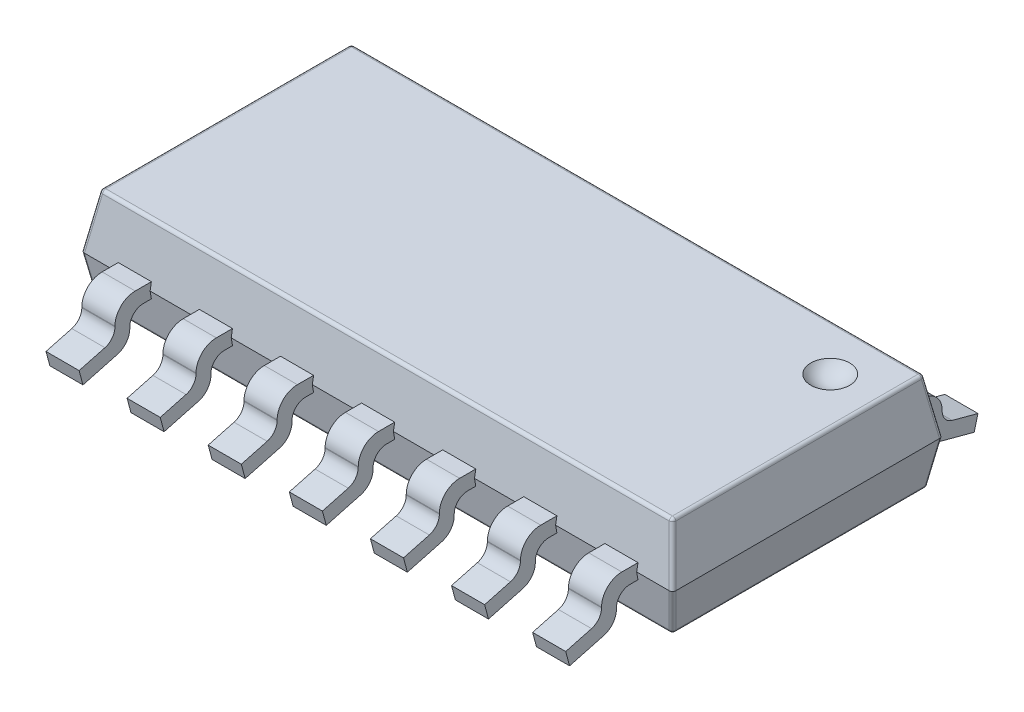
from build123d import *

# Parameters (mm, degrees)
BOSS_EXTRUDE1_DEPTH   = 4.375
CUT_EXTRUDE1_DEPTH    = 4.375
FILLET1_R             = 0.05
BOSS_EXTRUDE2_DEPTH   = 0.245
LPATTERN1_COUNT       = 4
LPATTERN1_PITCH       = 1.2
LPATTERN1_COUNT_DIR2  = 4
LPATTERN1_PITCH_DIR2  = 1.2
MIRROR1_COPY_1_DEPTH  = 0.245
MIRROR1_COPY_2_DEPTH  = 0.245
MIRROR1_COPY_3_DEPTH  = 0.245
MIRROR1_COPY_4_DEPTH  = 0.245
MIRROR1_COPY_5_DEPTH  = 0.245
MIRROR1_COPY_6_DEPTH  = 0.245
MIRROR1_COPY_7_DEPTH  = 0.245
MIRROR1_COPY_8_DEPTH  = 0.245
MIRROR1_COPY_9_DEPTH  = 0.245
MIRROR1_COPY_10_DEPTH = 0.245
MIRROR1_COPY_11_DEPTH = 0.245
MIRROR1_COPY_12_DEPTH = 0.245
MIRROR1_COPY_13_DEPTH = 0.245
MIRROR1_COPY_14_DEPTH = 0.245
MIRROR1_COPY_15_DEPTH = 0.245


with BuildPart() as part:
    # Sketch3 → Boss-Extrude1 (new, symmetric)
    with BuildSketch(Plane(origin=(0, 0, 0), x_dir=(0, 0, -1), z_dir=(1, 0, 0))):
        Polygon((-2, 0), (-1.885387463, -0.65), (1.885387463, -0.65), (2, 0), (1.858938415, 0.8), (-1.858938415, 0.8), align=None)
    extrude(amount=BOSS_EXTRUDE1_DEPTH, both=True)

    # Sketch4 → Cut-Extrude1 (cut, symmetric)
    with BuildSketch(Plane.XY):
        Polygon((-4.375, 0), (-4.233938415, 0.8), (-4.741857138, 0.8), (-4.741857138, -0.65), (-4.260387463, -0.65), align=None)
        Polygon((4.741857138, -0.65), (4.741857138, 0.8), (4.233938415, 0.8), (4.375, 0), (4.260387463, -0.65), align=None)
    extrude(amount=CUT_EXTRUDE1_DEPTH, both=True, mode=Mode.SUBTRACT)

    # Fillet1
    fillet1_edges = [part.edges().sort_by_distance(p)[0] for p in [
        (0, -0.65, -1.885387463),
        (-4.260387463, -0.65, 0),
        (0, -0.65, 1.885387463),
        (-4.233938415, 0.8, 0),
        (0, 0.8, -1.858938415),
        (4.317693731, -0.325, -1.942693731),
        (4.304469208, 0.4, -1.929469208),
        (4.233938415, 0.8, 0),
        (4.260387463, -0.65, 0),
        (4.317693731, -0.325, 1.942693731),
        (4.304469208, 0.4, 1.929469208),
        (0, 0.8, 1.858938415),
        (-4.317693731, -0.325, 1.942693731),
        (-4.304469208, 0.4, 1.929469208),
        (-4.317693731, -0.325, -1.942693731),
        (-4.304469208, 0.4, -1.929469208),
    ]]
    fillet(fillet1_edges, radius=FILLET1_R)

    # Sketch5 → Boss-Extrude2 (add, symmetric)
    with BuildSketch(Plane(origin=(0, 0, 0), x_dir=(0, 0, -1), z_dir=(1, 0, 0))):
        with BuildLine():
            Line((-1.980604032, 0.11), (-2, 0))
            Line((-2, 0), (-1.980604032, -0.11))
            Line((-1.980604032, -0.11), (-2.1, -0.11))
            ThreePointArc((-2.1, -0.11), (-2.241421356, -0.168578644), (-2.3, -0.31))
            Line((-2.3, -0.31), (-2.3, -0.329218636))
            ThreePointArc((-2.3, -0.329218636), (-2.351661665, -0.481408993), (-2.485295239, -0.570700092))
            Line((-2.485295239, -0.570700092), (-2.99305981, -0.706755199))
            Line((-2.99305981, -0.706755199), (-3.05, -0.494251518))
            Line((-3.05, -0.494251518), (-2.668236191, -0.391958213))
            ThreePointArc((-2.668236191, -0.391958213), (-2.561329332, -0.320525334), (-2.52, -0.198773048))
            Line((-2.52, -0.198773048), (-2.52, -0.19))
            ThreePointArc((-2.52, -0.19), (-2.432132034, 0.022132034), (-2.22, 0.11))
            Line((-2.22, 0.11), (-2.180725376, 0.11))
            Line((-2.180725376, 0.11), (-1.980604032, 0.11))
        make_face()
    boss_extrude2 = extrude(amount=BOSS_EXTRUDE2_DEPTH, both=True)

    # LPattern1: Boss-Extrude2 4 × 4
    with Locations(*[Vector(1, 0, 0) * (i * LPATTERN1_PITCH) + Vector(-1, 0, 0) * (j * LPATTERN1_PITCH_DIR2) for i in range(LPATTERN1_COUNT) for j in range(LPATTERN1_COUNT_DIR2) if (i, j) != (0, 0)]):
        add(boss_extrude2)

    # Mirror1: Boss-Extrude2 across plane
    add(boss_extrude2.mirror(Plane.XY))

    # Mirror1 copy 1 sketch → Mirror1 copy 1 (add, symmetric)
    with BuildSketch(Plane(origin=(-1.2, 0, 0), x_dir=(0, 0, 1), z_dir=(1, 0, 0))):
        with BuildLine():
            Line((-1.980604032, -0.11), (-2, 0))
            Line((-2, 0), (-1.980604032, 0.11))
            Line((-1.980604032, 0.11), (-2.1, 0.11))
            ThreePointArc((-2.1, 0.11), (-2.241421356, 0.168578644), (-2.3, 0.31))
            Line((-2.3, 0.31), (-2.3, 0.329218636))
            ThreePointArc((-2.3, 0.329218636), (-2.351661665, 0.481408993), (-2.485295239, 0.570700092))
            Line((-2.485295239, 0.570700092), (-2.99305981, 0.706755199))
            Line((-2.99305981, 0.706755199), (-3.05, 0.494251518))
            Line((-3.05, 0.494251518), (-2.668236191, 0.391958213))
            ThreePointArc((-2.668236191, 0.391958213), (-2.561329332, 0.320525334), (-2.52, 0.198773048))
            Line((-2.52, 0.198773048), (-2.52, 0.19))
            ThreePointArc((-2.52, 0.19), (-2.432132034, -0.022132034), (-2.22, -0.11))
            Line((-2.22, -0.11), (-2.180725376, -0.11))
            Line((-2.180725376, -0.11), (-1.980604032, -0.11))
        make_face()
    extrude(amount=MIRROR1_COPY_1_DEPTH, both=True)

    # Mirror1 copy 2 sketch → Mirror1 copy 2 (add, symmetric)
    with BuildSketch(Plane(origin=(-2.4, 0, 0), x_dir=(0, 0, 1), z_dir=(1, 0, 0))):
        with BuildLine():
            Line((-1.980604032, -0.11), (-2, 0))
            Line((-2, 0), (-1.980604032, 0.11))
            Line((-1.980604032, 0.11), (-2.1, 0.11))
            ThreePointArc((-2.1, 0.11), (-2.241421356, 0.168578644), (-2.3, 0.31))
            Line((-2.3, 0.31), (-2.3, 0.329218636))
            ThreePointArc((-2.3, 0.329218636), (-2.351661665, 0.481408993), (-2.485295239, 0.570700092))
            Line((-2.485295239, 0.570700092), (-2.99305981, 0.706755199))
            Line((-2.99305981, 0.706755199), (-3.05, 0.494251518))
            Line((-3.05, 0.494251518), (-2.668236191, 0.391958213))
            ThreePointArc((-2.668236191, 0.391958213), (-2.561329332, 0.320525334), (-2.52, 0.198773048))
            Line((-2.52, 0.198773048), (-2.52, 0.19))
            ThreePointArc((-2.52, 0.19), (-2.432132034, -0.022132034), (-2.22, -0.11))
            Line((-2.22, -0.11), (-2.180725376, -0.11))
            Line((-2.180725376, -0.11), (-1.980604032, -0.11))
        make_face()
    extrude(amount=MIRROR1_COPY_2_DEPTH, both=True)

    # Mirror1 copy 3 sketch → Mirror1 copy 3 (add, symmetric)
    with BuildSketch(Plane(origin=(-3.6, 0, 0), x_dir=(0, 0, 1), z_dir=(1, 0, 0))):
        with BuildLine():
            Line((-1.980604032, -0.11), (-2, 0))
            Line((-2, 0), (-1.980604032, 0.11))
            Line((-1.980604032, 0.11), (-2.1, 0.11))
            ThreePointArc((-2.1, 0.11), (-2.241421356, 0.168578644), (-2.3, 0.31))
            Line((-2.3, 0.31), (-2.3, 0.329218636))
            ThreePointArc((-2.3, 0.329218636), (-2.351661665, 0.481408993), (-2.485295239, 0.570700092))
            Line((-2.485295239, 0.570700092), (-2.99305981, 0.706755199))
            Line((-2.99305981, 0.706755199), (-3.05, 0.494251518))
            Line((-3.05, 0.494251518), (-2.668236191, 0.391958213))
            ThreePointArc((-2.668236191, 0.391958213), (-2.561329332, 0.320525334), (-2.52, 0.198773048))
            Line((-2.52, 0.198773048), (-2.52, 0.19))
            ThreePointArc((-2.52, 0.19), (-2.432132034, -0.022132034), (-2.22, -0.11))
            Line((-2.22, -0.11), (-2.180725376, -0.11))
            Line((-2.180725376, -0.11), (-1.980604032, -0.11))
        make_face()
    extrude(amount=MIRROR1_COPY_3_DEPTH, both=True)

    # Mirror1 copy 4 sketch → Mirror1 copy 4 (add, symmetric)
    with BuildSketch(Plane(origin=(1.2, 0, 0), x_dir=(0, 0, 1), z_dir=(1, 0, 0))):
        with BuildLine():
            Line((-1.980604032, -0.11), (-2, 0))
            Line((-2, 0), (-1.980604032, 0.11))
            Line((-1.980604032, 0.11), (-2.1, 0.11))
            ThreePointArc((-2.1, 0.11), (-2.241421356, 0.168578644), (-2.3, 0.31))
            Line((-2.3, 0.31), (-2.3, 0.329218636))
            ThreePointArc((-2.3, 0.329218636), (-2.351661665, 0.481408993), (-2.485295239, 0.570700092))
            Line((-2.485295239, 0.570700092), (-2.99305981, 0.706755199))
            Line((-2.99305981, 0.706755199), (-3.05, 0.494251518))
            Line((-3.05, 0.494251518), (-2.668236191, 0.391958213))
            ThreePointArc((-2.668236191, 0.391958213), (-2.561329332, 0.320525334), (-2.52, 0.198773048))
            Line((-2.52, 0.198773048), (-2.52, 0.19))
            ThreePointArc((-2.52, 0.19), (-2.432132034, -0.022132034), (-2.22, -0.11))
            Line((-2.22, -0.11), (-2.180725376, -0.11))
            Line((-2.180725376, -0.11), (-1.980604032, -0.11))
        make_face()
    extrude(amount=MIRROR1_COPY_4_DEPTH, both=True)

    # Mirror1 copy 5 sketch → Mirror1 copy 5 (add, symmetric)
    with BuildSketch(Plane(origin=(0, 0, 0), x_dir=(0, 0, 1), z_dir=(1, 0, 0))):
        with BuildLine():
            Line((-1.980604032, -0.11), (-2, 0))
            Line((-2, 0), (-1.980604032, 0.11))
            Line((-1.980604032, 0.11), (-2.1, 0.11))
            ThreePointArc((-2.1, 0.11), (-2.241421356, 0.168578644), (-2.3, 0.31))
            Line((-2.3, 0.31), (-2.3, 0.329218636))
            ThreePointArc((-2.3, 0.329218636), (-2.351661665, 0.481408993), (-2.485295239, 0.570700092))
            Line((-2.485295239, 0.570700092), (-2.99305981, 0.706755199))
            Line((-2.99305981, 0.706755199), (-3.05, 0.494251518))
            Line((-3.05, 0.494251518), (-2.668236191, 0.391958213))
            ThreePointArc((-2.668236191, 0.391958213), (-2.561329332, 0.320525334), (-2.52, 0.198773048))
            Line((-2.52, 0.198773048), (-2.52, 0.19))
            ThreePointArc((-2.52, 0.19), (-2.432132034, -0.022132034), (-2.22, -0.11))
            Line((-2.22, -0.11), (-2.180725376, -0.11))
            Line((-2.180725376, -0.11), (-1.980604032, -0.11))
        make_face()
    extrude(amount=MIRROR1_COPY_5_DEPTH, both=True)

    # Mirror1 copy 6 sketch → Mirror1 copy 6 (add, symmetric)
    with BuildSketch(Plane(origin=(-1.2, 0, 0), x_dir=(0, 0, 1), z_dir=(1, 0, 0))):
        with BuildLine():
            Line((-1.980604032, -0.11), (-2, 0))
            Line((-2, 0), (-1.980604032, 0.11))
            Line((-1.980604032, 0.11), (-2.1, 0.11))
            ThreePointArc((-2.1, 0.11), (-2.241421356, 0.168578644), (-2.3, 0.31))
            Line((-2.3, 0.31), (-2.3, 0.329218636))
            ThreePointArc((-2.3, 0.329218636), (-2.351661665, 0.481408993), (-2.485295239, 0.570700092))
            Line((-2.485295239, 0.570700092), (-2.99305981, 0.706755199))
            Line((-2.99305981, 0.706755199), (-3.05, 0.494251518))
            Line((-3.05, 0.494251518), (-2.668236191, 0.391958213))
            ThreePointArc((-2.668236191, 0.391958213), (-2.561329332, 0.320525334), (-2.52, 0.198773048))
            Line((-2.52, 0.198773048), (-2.52, 0.19))
            ThreePointArc((-2.52, 0.19), (-2.432132034, -0.022132034), (-2.22, -0.11))
            Line((-2.22, -0.11), (-2.180725376, -0.11))
            Line((-2.180725376, -0.11), (-1.980604032, -0.11))
        make_face()
    extrude(amount=MIRROR1_COPY_6_DEPTH, both=True)

    # Mirror1 copy 7 sketch → Mirror1 copy 7 (add, symmetric)
    with BuildSketch(Plane(origin=(-2.4, 0, 0), x_dir=(0, 0, 1), z_dir=(1, 0, 0))):
        with BuildLine():
            Line((-1.980604032, -0.11), (-2, 0))
            Line((-2, 0), (-1.980604032, 0.11))
            Line((-1.980604032, 0.11), (-2.1, 0.11))
            ThreePointArc((-2.1, 0.11), (-2.241421356, 0.168578644), (-2.3, 0.31))
            Line((-2.3, 0.31), (-2.3, 0.329218636))
            ThreePointArc((-2.3, 0.329218636), (-2.351661665, 0.481408993), (-2.485295239, 0.570700092))
            Line((-2.485295239, 0.570700092), (-2.99305981, 0.706755199))
            Line((-2.99305981, 0.706755199), (-3.05, 0.494251518))
            Line((-3.05, 0.494251518), (-2.668236191, 0.391958213))
            ThreePointArc((-2.668236191, 0.391958213), (-2.561329332, 0.320525334), (-2.52, 0.198773048))
            Line((-2.52, 0.198773048), (-2.52, 0.19))
            ThreePointArc((-2.52, 0.19), (-2.432132034, -0.022132034), (-2.22, -0.11))
            Line((-2.22, -0.11), (-2.180725376, -0.11))
            Line((-2.180725376, -0.11), (-1.980604032, -0.11))
        make_face()
    extrude(amount=MIRROR1_COPY_7_DEPTH, both=True)

    # Mirror1 copy 8 sketch → Mirror1 copy 8 (add, symmetric)
    with BuildSketch(Plane(origin=(2.4, 0, 0), x_dir=(0, 0, 1), z_dir=(1, 0, 0))):
        with BuildLine():
            Line((-1.980604032, -0.11), (-2, 0))
            Line((-2, 0), (-1.980604032, 0.11))
            Line((-1.980604032, 0.11), (-2.1, 0.11))
            ThreePointArc((-2.1, 0.11), (-2.241421356, 0.168578644), (-2.3, 0.31))
            Line((-2.3, 0.31), (-2.3, 0.329218636))
            ThreePointArc((-2.3, 0.329218636), (-2.351661665, 0.481408993), (-2.485295239, 0.570700092))
            Line((-2.485295239, 0.570700092), (-2.99305981, 0.706755199))
            Line((-2.99305981, 0.706755199), (-3.05, 0.494251518))
            Line((-3.05, 0.494251518), (-2.668236191, 0.391958213))
            ThreePointArc((-2.668236191, 0.391958213), (-2.561329332, 0.320525334), (-2.52, 0.198773048))
            Line((-2.52, 0.198773048), (-2.52, 0.19))
            ThreePointArc((-2.52, 0.19), (-2.432132034, -0.022132034), (-2.22, -0.11))
            Line((-2.22, -0.11), (-2.180725376, -0.11))
            Line((-2.180725376, -0.11), (-1.980604032, -0.11))
        make_face()
    extrude(amount=MIRROR1_COPY_8_DEPTH, both=True)

    # Mirror1 copy 9 sketch → Mirror1 copy 9 (add, symmetric)
    with BuildSketch(Plane(origin=(1.2, 0, 0), x_dir=(0, 0, 1), z_dir=(1, 0, 0))):
        with BuildLine():
            Line((-1.980604032, -0.11), (-2, 0))
            Line((-2, 0), (-1.980604032, 0.11))
            Line((-1.980604032, 0.11), (-2.1, 0.11))
            ThreePointArc((-2.1, 0.11), (-2.241421356, 0.168578644), (-2.3, 0.31))
            Line((-2.3, 0.31), (-2.3, 0.329218636))
            ThreePointArc((-2.3, 0.329218636), (-2.351661665, 0.481408993), (-2.485295239, 0.570700092))
            Line((-2.485295239, 0.570700092), (-2.99305981, 0.706755199))
            Line((-2.99305981, 0.706755199), (-3.05, 0.494251518))
            Line((-3.05, 0.494251518), (-2.668236191, 0.391958213))
            ThreePointArc((-2.668236191, 0.391958213), (-2.561329332, 0.320525334), (-2.52, 0.198773048))
            Line((-2.52, 0.198773048), (-2.52, 0.19))
            ThreePointArc((-2.52, 0.19), (-2.432132034, -0.022132034), (-2.22, -0.11))
            Line((-2.22, -0.11), (-2.180725376, -0.11))
            Line((-2.180725376, -0.11), (-1.980604032, -0.11))
        make_face()
    extrude(amount=MIRROR1_COPY_9_DEPTH, both=True)

    # Mirror1 copy 10 sketch → Mirror1 copy 10 (add, symmetric)
    with BuildSketch(Plane(origin=(0, 0, 0), x_dir=(0, 0, 1), z_dir=(1, 0, 0))):
        with BuildLine():
            Line((-1.980604032, -0.11), (-2, 0))
            Line((-2, 0), (-1.980604032, 0.11))
            Line((-1.980604032, 0.11), (-2.1, 0.11))
            ThreePointArc((-2.1, 0.11), (-2.241421356, 0.168578644), (-2.3, 0.31))
            Line((-2.3, 0.31), (-2.3, 0.329218636))
            ThreePointArc((-2.3, 0.329218636), (-2.351661665, 0.481408993), (-2.485295239, 0.570700092))
            Line((-2.485295239, 0.570700092), (-2.99305981, 0.706755199))
            Line((-2.99305981, 0.706755199), (-3.05, 0.494251518))
            Line((-3.05, 0.494251518), (-2.668236191, 0.391958213))
            ThreePointArc((-2.668236191, 0.391958213), (-2.561329332, 0.320525334), (-2.52, 0.198773048))
            Line((-2.52, 0.198773048), (-2.52, 0.19))
            ThreePointArc((-2.52, 0.19), (-2.432132034, -0.022132034), (-2.22, -0.11))
            Line((-2.22, -0.11), (-2.180725376, -0.11))
            Line((-2.180725376, -0.11), (-1.980604032, -0.11))
        make_face()
    extrude(amount=MIRROR1_COPY_10_DEPTH, both=True)

    # Mirror1 copy 11 sketch → Mirror1 copy 11 (add, symmetric)
    with BuildSketch(Plane(origin=(-1.2, 0, 0), x_dir=(0, 0, 1), z_dir=(1, 0, 0))):
        with BuildLine():
            Line((-1.980604032, -0.11), (-2, 0))
            Line((-2, 0), (-1.980604032, 0.11))
            Line((-1.980604032, 0.11), (-2.1, 0.11))
            ThreePointArc((-2.1, 0.11), (-2.241421356, 0.168578644), (-2.3, 0.31))
            Line((-2.3, 0.31), (-2.3, 0.329218636))
            ThreePointArc((-2.3, 0.329218636), (-2.351661665, 0.481408993), (-2.485295239, 0.570700092))
            Line((-2.485295239, 0.570700092), (-2.99305981, 0.706755199))
            Line((-2.99305981, 0.706755199), (-3.05, 0.494251518))
            Line((-3.05, 0.494251518), (-2.668236191, 0.391958213))
            ThreePointArc((-2.668236191, 0.391958213), (-2.561329332, 0.320525334), (-2.52, 0.198773048))
            Line((-2.52, 0.198773048), (-2.52, 0.19))
            ThreePointArc((-2.52, 0.19), (-2.432132034, -0.022132034), (-2.22, -0.11))
            Line((-2.22, -0.11), (-2.180725376, -0.11))
            Line((-2.180725376, -0.11), (-1.980604032, -0.11))
        make_face()
    extrude(amount=MIRROR1_COPY_11_DEPTH, both=True)

    # Mirror1 copy 12 sketch → Mirror1 copy 12 (add, symmetric)
    with BuildSketch(Plane(origin=(3.6, 0, 0), x_dir=(0, 0, 1), z_dir=(1, 0, 0))):
        with BuildLine():
            Line((-1.980604032, -0.11), (-2, 0))
            Line((-2, 0), (-1.980604032, 0.11))
            Line((-1.980604032, 0.11), (-2.1, 0.11))
            ThreePointArc((-2.1, 0.11), (-2.241421356, 0.168578644), (-2.3, 0.31))
            Line((-2.3, 0.31), (-2.3, 0.329218636))
            ThreePointArc((-2.3, 0.329218636), (-2.351661665, 0.481408993), (-2.485295239, 0.570700092))
            Line((-2.485295239, 0.570700092), (-2.99305981, 0.706755199))
            Line((-2.99305981, 0.706755199), (-3.05, 0.494251518))
            Line((-3.05, 0.494251518), (-2.668236191, 0.391958213))
            ThreePointArc((-2.668236191, 0.391958213), (-2.561329332, 0.320525334), (-2.52, 0.198773048))
            Line((-2.52, 0.198773048), (-2.52, 0.19))
            ThreePointArc((-2.52, 0.19), (-2.432132034, -0.022132034), (-2.22, -0.11))
            Line((-2.22, -0.11), (-2.180725376, -0.11))
            Line((-2.180725376, -0.11), (-1.980604032, -0.11))
        make_face()
    extrude(amount=MIRROR1_COPY_12_DEPTH, both=True)

    # Mirror1 copy 13 sketch → Mirror1 copy 13 (add, symmetric)
    with BuildSketch(Plane(origin=(2.4, 0, 0), x_dir=(0, 0, 1), z_dir=(1, 0, 0))):
        with BuildLine():
            Line((-1.980604032, -0.11), (-2, 0))
            Line((-2, 0), (-1.980604032, 0.11))
            Line((-1.980604032, 0.11), (-2.1, 0.11))
            ThreePointArc((-2.1, 0.11), (-2.241421356, 0.168578644), (-2.3, 0.31))
            Line((-2.3, 0.31), (-2.3, 0.329218636))
            ThreePointArc((-2.3, 0.329218636), (-2.351661665, 0.481408993), (-2.485295239, 0.570700092))
            Line((-2.485295239, 0.570700092), (-2.99305981, 0.706755199))
            Line((-2.99305981, 0.706755199), (-3.05, 0.494251518))
            Line((-3.05, 0.494251518), (-2.668236191, 0.391958213))
            ThreePointArc((-2.668236191, 0.391958213), (-2.561329332, 0.320525334), (-2.52, 0.198773048))
            Line((-2.52, 0.198773048), (-2.52, 0.19))
            ThreePointArc((-2.52, 0.19), (-2.432132034, -0.022132034), (-2.22, -0.11))
            Line((-2.22, -0.11), (-2.180725376, -0.11))
            Line((-2.180725376, -0.11), (-1.980604032, -0.11))
        make_face()
    extrude(amount=MIRROR1_COPY_13_DEPTH, both=True)

    # Mirror1 copy 14 sketch → Mirror1 copy 14 (add, symmetric)
    with BuildSketch(Plane(origin=(1.2, 0, 0), x_dir=(0, 0, 1), z_dir=(1, 0, 0))):
        with BuildLine():
            Line((-1.980604032, -0.11), (-2, 0))
            Line((-2, 0), (-1.980604032, 0.11))
            Line((-1.980604032, 0.11), (-2.1, 0.11))
            ThreePointArc((-2.1, 0.11), (-2.241421356, 0.168578644), (-2.3, 0.31))
            Line((-2.3, 0.31), (-2.3, 0.329218636))
            ThreePointArc((-2.3, 0.329218636), (-2.351661665, 0.481408993), (-2.485295239, 0.570700092))
            Line((-2.485295239, 0.570700092), (-2.99305981, 0.706755199))
            Line((-2.99305981, 0.706755199), (-3.05, 0.494251518))
            Line((-3.05, 0.494251518), (-2.668236191, 0.391958213))
            ThreePointArc((-2.668236191, 0.391958213), (-2.561329332, 0.320525334), (-2.52, 0.198773048))
            Line((-2.52, 0.198773048), (-2.52, 0.19))
            ThreePointArc((-2.52, 0.19), (-2.432132034, -0.022132034), (-2.22, -0.11))
            Line((-2.22, -0.11), (-2.180725376, -0.11))
            Line((-2.180725376, -0.11), (-1.980604032, -0.11))
        make_face()
    extrude(amount=MIRROR1_COPY_14_DEPTH, both=True)

    # Mirror1 copy 15 sketch → Mirror1 copy 15 (add, symmetric)
    with BuildSketch(Plane(origin=(0, 0, 0), x_dir=(0, 0, 1), z_dir=(1, 0, 0))):
        with BuildLine():
            Line((-1.980604032, -0.11), (-2, 0))
            Line((-2, 0), (-1.980604032, 0.11))
            Line((-1.980604032, 0.11), (-2.1, 0.11))
            ThreePointArc((-2.1, 0.11), (-2.241421356, 0.168578644), (-2.3, 0.31))
            Line((-2.3, 0.31), (-2.3, 0.329218636))
            ThreePointArc((-2.3, 0.329218636), (-2.351661665, 0.481408993), (-2.485295239, 0.570700092))
            Line((-2.485295239, 0.570700092), (-2.99305981, 0.706755199))
            Line((-2.99305981, 0.706755199), (-3.05, 0.494251518))
            Line((-3.05, 0.494251518), (-2.668236191, 0.391958213))
            ThreePointArc((-2.668236191, 0.391958213), (-2.561329332, 0.320525334), (-2.52, 0.198773048))
            Line((-2.52, 0.198773048), (-2.52, 0.19))
            ThreePointArc((-2.52, 0.19), (-2.432132034, -0.022132034), (-2.22, -0.11))
            Line((-2.22, -0.11), (-2.180725376, -0.11))
            Line((-2.180725376, -0.11), (-1.980604032, -0.11))
        make_face()
    extrude(amount=MIRROR1_COPY_15_DEPTH, both=True)

    # Sketch6 → Cut-Revolve1 (revolve, cut)
    with BuildSketch(Plane(origin=(0, 1, 0), x_dir=(1, 0, 0), z_dir=(0, 1, 0))):
        with BuildLine():
            Line((3.191983434, 1.166983434), (3.891983434, 1.166983434))
            ThreePointArc((3.891983434, 1.166983434), (3.541983434, 1.516983434), (3.191983434, 1.166983434))
        make_face()
    revolve(axis=Axis((3.191983434, 1, -1.166983434), (1, 0, 0)), mode=Mode.SUBTRACT)


solid = part.part
